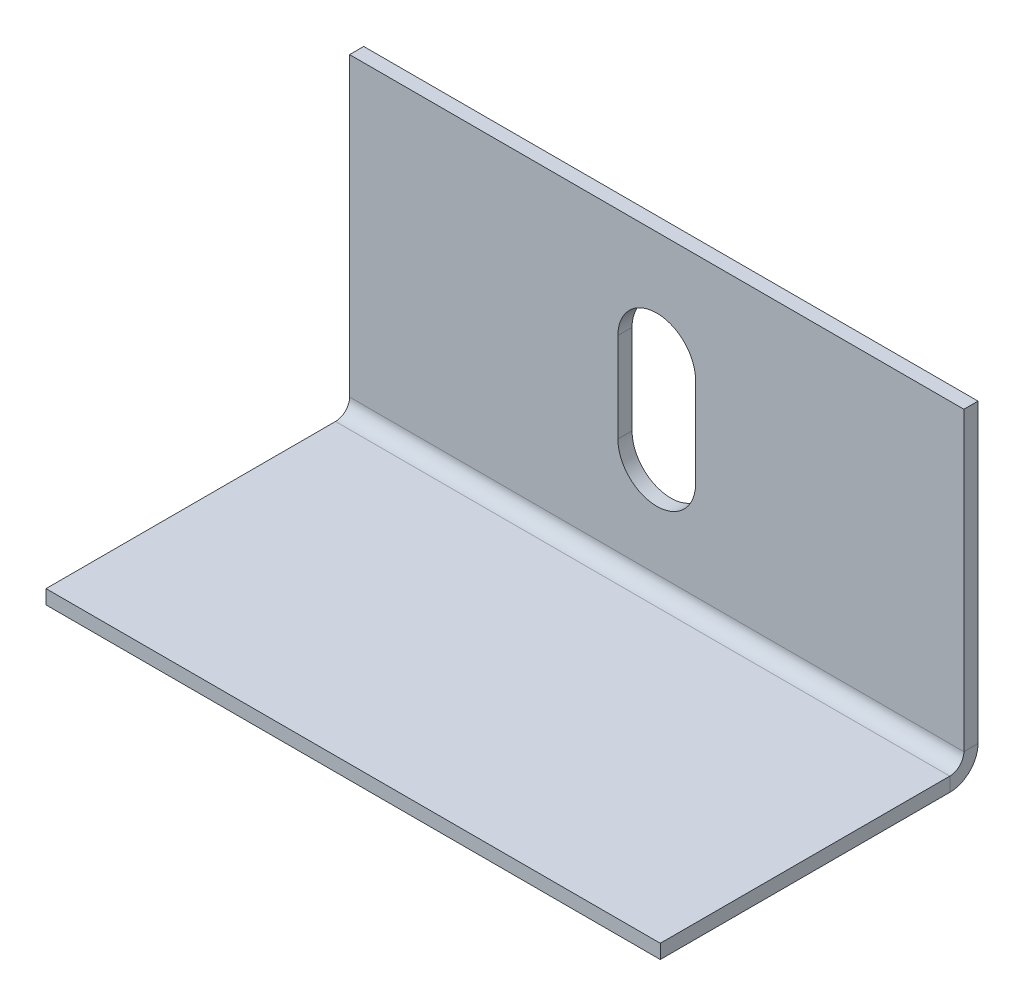
from build123d import *

# Parameters (mm, degrees)
SKETCH1_W                    = 87
SKETCH1_H                    = 43
BASE_FLANGE1_DEPTH           = 2
EDGE_FLANGE1_STRIP_W         = 12
EDGE_FLANGE1_STRIP_H         = 2
EDGE_FLANGE1_STRIP_CUT_DEPTH = 87
EDGE_FLANGE1_DEPTH           = 87
CUT_EXTRUDE1_DEPTH           = 10


# Sheet-metal steps are written as plain solids
with BuildPart() as part:
    # Sketch1 → Base-Flange1 (new body)
    with BuildSketch(Plane(origin=(0, 0, 0), x_dir=(1, 0, 0), z_dir=(0, 1, 0))):
        Rectangle(SKETCH1_W, SKETCH1_H)
    extrude(amount=-BASE_FLANGE1_DEPTH)

    # Edge-Flange1 strip (across the edge) → Edge-Flange1 strip cut (cut)
    with BuildSketch(Plane(origin=(43.5, 0, -21.5), x_dir=(0, 0, 1), z_dir=(-1, 0, 0))):
        with Locations((-4, -1)):
            Rectangle(EDGE_FLANGE1_STRIP_W, EDGE_FLANGE1_STRIP_H)
    extrude(amount=EDGE_FLANGE1_STRIP_CUT_DEPTH, mode=Mode.SUBTRACT)

    # Edge-Flange1 section (across the edge) → Edge-Flange1 (add)
    with BuildSketch(Plane(origin=(43.5, 0, -21.5), x_dir=(0, 0, 1), z_dir=(-1, 0, 0))):
        with BuildLine():
            Line((-2, 2), (-2, 44))
            Line((-2, 44), (0, 44))
            Line((0, 44), (0, 2))
            ThreePointArc((0, 2), (0.585786438, 0.585786438), (2, 0))
            Line((2, 0), (2, -2))
            ThreePointArc((2, -2), (-0.828427125, -0.828427125), (-2, 2))
        make_face()
    extrude(amount=EDGE_FLANGE1_DEPTH)

    # Sketch9 → Cut-Extrude1 (cut)
    with BuildSketch(Plane(origin=(0, 0, -23.5), x_dir=(-1, 0, 0), z_dir=(0, 0, -1))):
        with BuildLine():
            Line((5.5, 28.548666546), (5.5, 15.848666546))
            ThreePointArc((5.5, 15.848666546), (0, 10.348666546), (-5.5, 15.848666546))
            Line((-5.5, 15.848666546), (-5.5, 28.548666546))
            ThreePointArc((-5.5, 28.548666546), (0, 34.048666546), (5.5, 28.548666546))
        make_face()
    extrude(amount=-CUT_EXTRUDE1_DEPTH, mode=Mode.SUBTRACT)


solid = part.part
